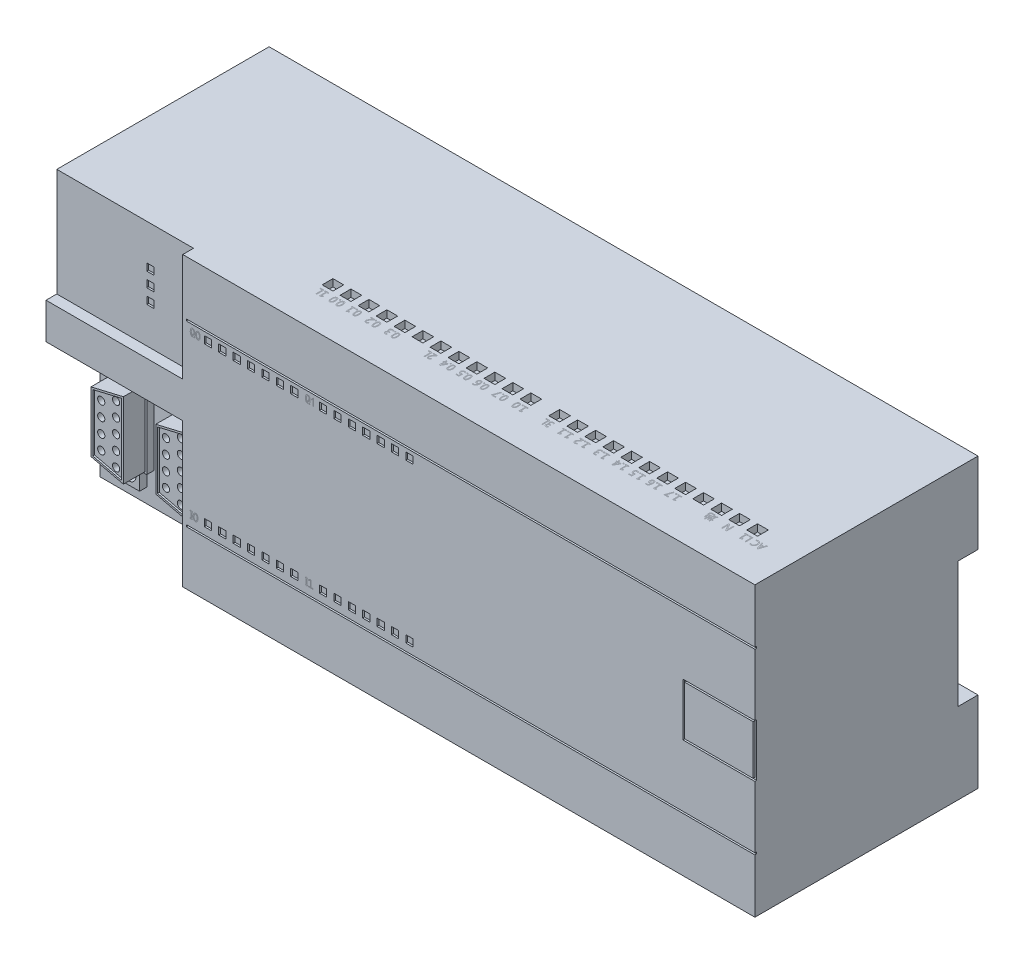
from build123d import *

# Parameters (mm, degrees)
EXTRUDE_1_DEPTH      = 197
SKETCH_2_W           = 38
SKETCH_2_H           = 40
CUT_EXTRUDE_1_DEPTH  = 15
SKETCH_2_4_W         = 20
SKETCH_2_4_H         = 14.644787542
SKETCH_2_4_W_2       = 19
SKETCH_2_4_H_2       = 13.644787542
SKETCH_2_4_W_3       = 158
SKETCH_2_4_H_3       = 0.5
SKETCH_2_4_W_4       = 2
SKETCH_2_4_H_4       = 2
CUT_EXTRUDE_2_DEPTH  = 0.5
SKETCH_2_5_W         = 38
SKETCH_2_5_H         = 30
CUT_EXTRUDE_3_DEPTH  = 3
SKETCH_2_6_W         = 2
SKETCH_2_6_H         = 2
CUT_EXTRUDE_4_DEPTH  = 3.5
CUT_EXTRUDE_5_DEPTH  = 13
SKETCH_2_8_R         = 2
CUT_EXTRUDE_6_DEPTH  = 15
SKETCH_2_9_R         = 1
CUT_EXTRUDE_7_DEPTH  = 15
CUT_EXTRUDE_8_DEPTH  = 7.5
CUT_EXTRUDE_9_DEPTH  = 7
SKETCH_4_W           = 3
SKETCH_4_H           = 3
CUT_EXTRUDE_10_DEPTH = 2
SKETCH_5_W           = 3
SKETCH_5_H           = 3
CUT_EXTRUDE_11_DEPTH = 2


with BuildPart() as part:
    # 草图1 → 凸台-拉伸1 (new body)
    with BuildSketch(Plane(origin=(0, 0, 0), x_dir=(0, 0, -1), z_dir=(1, 0, 0))):
        Polygon((62, -57.5), (62, -80), (0, -80), (0, 0), (62, 0), (62, -22.5), (56.5, -22.5), (56.5, -57.5), align=None)
    extrude(amount=EXTRUDE_1_DEPTH)

    # 草图2 → 切除-拉伸1 (cut)
    with BuildSketch(Plane.XY):
        with Locations((19, -60)):
            Rectangle(SKETCH_2_W, SKETCH_2_H)
        Polygon((7, -49.013480083), (7, -44.013480083), (13, -44.013480083), (13, -49.013480083), (15, -49.013480083), (15, -70.986519917), (13, -70.986519917), (13, -75.986519917), (7, -75.986519917), (7, -70.986519917), (5, -70.986519917), (5, -49.013480083), align=None, mode=Mode.SUBTRACT)
        Polygon((25, -49.013480083), (25, -44.013480083), (31, -44.013480083), (31, -49.013480083), (33, -49.013480083), (33, -70.986519917), (31, -70.986519917), (31, -75.986519917), (25, -75.986519917), (25, -70.986519917), (23, -70.986519917), (23, -49.013480083), align=None, mode=Mode.SUBTRACT)
    extrude(amount=-CUT_EXTRUDE_1_DEPTH, mode=Mode.SUBTRACT)

    # 草图2<4> → 切除-拉伸2 (cut)
    # profile 1 of 31: a face of its own
    with BuildSketch(Plane.XY):
        with Locations((187, -40)):
            Rectangle(SKETCH_2_4_W, SKETCH_2_4_H)
        with Locations((187, -40)):
            Rectangle(SKETCH_2_4_W_2, SKETCH_2_4_H_2, mode=Mode.SUBTRACT)
    # profile 2 of 31: a face of its own
    with BuildSketch(Plane.XY):
        with Locations((118, -15.25)):
            Rectangle(SKETCH_2_4_W_3, SKETCH_2_4_H_3)
    # profile 3 of 31: a face of its own
    with BuildSketch(Plane.XY):
        with Locations((118, -64.75)):
            Rectangle(SKETCH_2_4_W_3, SKETCH_2_4_H_3)
    # profile 4 of 31: a face of its own
    with BuildSketch(Plane.XY):
        with Locations((49, -61.5)):
            Rectangle(SKETCH_2_4_W_4, SKETCH_2_4_H_4)
    # profile 5 of 31: a face of its own
    with BuildSketch(Plane.XY):
        with Locations((45, -61.5)):
            Rectangle(SKETCH_2_4_W_4, SKETCH_2_4_H_4)
    # profile 6 of 31: a face of its own
    with BuildSketch(Plane.XY):
        with Locations((53, -61.5)):
            Rectangle(SKETCH_2_4_W_4, SKETCH_2_4_H_4)
    # profile 7 of 31: a face of its own
    with BuildSketch(Plane.XY):
        with Locations((57, -61.5)):
            Rectangle(SKETCH_2_4_W_4, SKETCH_2_4_H_4)
    # profile 8 of 31: a face of its own
    with BuildSketch(Plane.XY):
        with Locations((61, -61.5)):
            Rectangle(SKETCH_2_4_W_4, SKETCH_2_4_H_4)
    # profile 9 of 31: a face of its own
    with BuildSketch(Plane.XY):
        with Locations((65, -61.5)):
            Rectangle(SKETCH_2_4_W_4, SKETCH_2_4_H_4)
    # profile 10 of 31: a face of its own
    with BuildSketch(Plane.XY):
        with Locations((69, -61.5)):
            Rectangle(SKETCH_2_4_W_4, SKETCH_2_4_H_4)
    # profile 11 of 31: a face of its own
    with BuildSketch(Plane.XY):
        with Locations((77, -61.5)):
            Rectangle(SKETCH_2_4_W_4, SKETCH_2_4_H_4)
    # profile 12 of 31: a face of its own
    with BuildSketch(Plane.XY):
        with Locations((81, -61.5)):
            Rectangle(SKETCH_2_4_W_4, SKETCH_2_4_H_4)
    # profile 13 of 31: a face of its own
    with BuildSketch(Plane.XY):
        with Locations((85, -61.5)):
            Rectangle(SKETCH_2_4_W_4, SKETCH_2_4_H_4)
    # profile 14 of 31: a face of its own
    with BuildSketch(Plane.XY):
        with Locations((89, -61.5)):
            Rectangle(SKETCH_2_4_W_4, SKETCH_2_4_H_4)
    # profile 15 of 31: a face of its own
    with BuildSketch(Plane.XY):
        with Locations((93, -61.5)):
            Rectangle(SKETCH_2_4_W_4, SKETCH_2_4_H_4)
    # profile 16 of 31: a face of its own
    with BuildSketch(Plane.XY):
        with Locations((97, -61.5)):
            Rectangle(SKETCH_2_4_W_4, SKETCH_2_4_H_4)
    # profile 17 of 31: a face of its own
    with BuildSketch(Plane.XY):
        with Locations((101, -61.5)):
            Rectangle(SKETCH_2_4_W_4, SKETCH_2_4_H_4)
    # profile 18 of 31: a face of its own
    with BuildSketch(Plane.XY):
        with Locations((49, -17.5)):
            Rectangle(SKETCH_2_4_W_4, SKETCH_2_4_H_4)
    # profile 19 of 31: a face of its own
    with BuildSketch(Plane.XY):
        with Locations((53, -17.5)):
            Rectangle(SKETCH_2_4_W_4, SKETCH_2_4_H_4)
    # profile 20 of 31: a face of its own
    with BuildSketch(Plane.XY):
        with Locations((57, -17.5)):
            Rectangle(SKETCH_2_4_W_4, SKETCH_2_4_H_4)
    # profile 21 of 31: a face of its own
    with BuildSketch(Plane.XY):
        with Locations((61, -17.5)):
            Rectangle(SKETCH_2_4_W_4, SKETCH_2_4_H_4)
    # profile 22 of 31: a face of its own
    with BuildSketch(Plane.XY):
        with Locations((65, -17.5)):
            Rectangle(SKETCH_2_4_W_4, SKETCH_2_4_H_4)
    # profile 23 of 31: a face of its own
    with BuildSketch(Plane.XY):
        with Locations((69, -17.5)):
            Rectangle(SKETCH_2_4_W_4, SKETCH_2_4_H_4)
    # profile 24 of 31: a face of its own
    with BuildSketch(Plane.XY):
        with Locations((77, -17.5)):
            Rectangle(SKETCH_2_4_W_4, SKETCH_2_4_H_4)
    # profile 25 of 31: a face of its own
    with BuildSketch(Plane.XY):
        with Locations((81, -17.5)):
            Rectangle(SKETCH_2_4_W_4, SKETCH_2_4_H_4)
    # profile 26 of 31: a face of its own
    with BuildSketch(Plane.XY):
        with Locations((85, -17.5)):
            Rectangle(SKETCH_2_4_W_4, SKETCH_2_4_H_4)
    # profile 27 of 31: a face of its own
    with BuildSketch(Plane.XY):
        with Locations((89, -17.5)):
            Rectangle(SKETCH_2_4_W_4, SKETCH_2_4_H_4)
    # profile 28 of 31: a face of its own
    with BuildSketch(Plane.XY):
        with Locations((93, -17.5)):
            Rectangle(SKETCH_2_4_W_4, SKETCH_2_4_H_4)
    # profile 29 of 31: a face of its own
    with BuildSketch(Plane.XY):
        with Locations((97, -17.5)):
            Rectangle(SKETCH_2_4_W_4, SKETCH_2_4_H_4)
    # profile 30 of 31: a face of its own
    with BuildSketch(Plane.XY):
        with Locations((101, -17.5)):
            Rectangle(SKETCH_2_4_W_4, SKETCH_2_4_H_4)
    # profile 31 of 31: a face of its own
    with BuildSketch(Plane.XY):
        with Locations((45, -17.5)):
            Rectangle(SKETCH_2_4_W_4, SKETCH_2_4_H_4)
    extrude(amount=-CUT_EXTRUDE_2_DEPTH, mode=Mode.SUBTRACT)

    # 草图2<5> → 切除-拉伸3 (cut)
    with BuildSketch(Plane.XY):
        with Locations((19, -15)):
            Rectangle(SKETCH_2_5_W, SKETCH_2_5_H)
    extrude(amount=-CUT_EXTRUDE_3_DEPTH, mode=Mode.SUBTRACT)

    # 草图2<6> → 切除-拉伸4 (cut)
    with BuildSketch(Plane.XY):
        with Locations((26, -15)):
            Rectangle(SKETCH_2_6_W, SKETCH_2_6_H)
        with Locations((26, -11)):
            Rectangle(SKETCH_2_6_W, SKETCH_2_6_H)
        with Locations((26, -19)):
            Rectangle(SKETCH_2_6_W, SKETCH_2_6_H)
    extrude(amount=-CUT_EXTRUDE_4_DEPTH, mode=Mode.SUBTRACT)

    # 草图2<7> → 切除-拉伸5 (cut)
    # profile 1 of 2: a face of its own
    with BuildSketch(Plane.XY):
        Polygon((7, -49.013480083), (7, -44.013480083), (13, -44.013480083), (13, -49.013480083), (15, -49.013480083), (15, -70.986519917), (13, -70.986519917), (13, -75.986519917), (7, -75.986519917), (7, -70.986519917), (5, -70.986519917), (5, -49.013480083), align=None)
        Polygon((5.5, -51.60431894), (14.5, -49.479050457), (14.5, -70.520949543), (5.5, -68.39568106), align=None, mode=Mode.SUBTRACT)
    # profile 2 of 2: a face of its own
    with BuildSketch(Plane.XY):
        Polygon((25, -49.013480083), (25, -44.013480083), (31, -44.013480083), (31, -49.013480083), (33, -49.013480083), (33, -70.986519917), (31, -70.986519917), (31, -75.986519917), (25, -75.986519917), (25, -70.986519917), (23, -70.986519917), (23, -49.013480083), align=None)
        Polygon((23.5, -51.60431894), (32.5, -49.479050457), (32.5, -70.520949543), (23.5, -68.39568106), align=None, mode=Mode.SUBTRACT)
    extrude(amount=-CUT_EXTRUDE_5_DEPTH, mode=Mode.SUBTRACT)

    # 草图2<8> → 切除-拉伸6 (cut)
    with BuildSketch(Plane.XY):
        with Locations((10, -47.013480083)):
            Circle(SKETCH_2_8_R)
        with Locations((10, -72.986519917)):
            Circle(SKETCH_2_8_R)
        with Locations((28, -47.013480083)):
            Circle(SKETCH_2_8_R)
        with Locations((28, -72.986519917)):
            Circle(SKETCH_2_8_R)
    extrude(amount=-CUT_EXTRUDE_6_DEPTH, mode=Mode.SUBTRACT)

    # 草图2<9> → 切除-拉伸7 (cut)
    with BuildSketch(Plane.XY):
        with Locations((7.850312497, -54)):
            Circle(SKETCH_2_9_R)
        with Locations((7.850312497, -58)):
            Circle(SKETCH_2_9_R)
        with Locations((7.850312497, -62)):
            Circle(SKETCH_2_9_R)
        with Locations((7.850312497, -66)):
            Circle(SKETCH_2_9_R)
        with Locations((11.979833633, -52)):
            Circle(SKETCH_2_9_R)
        with Locations((11.979833633, -56)):
            Circle(SKETCH_2_9_R)
        with Locations((11.979833633, -60)):
            Circle(SKETCH_2_9_R)
        with Locations((11.979833633, -64)):
            Circle(SKETCH_2_9_R)
        with Locations((11.979833633, -68)):
            Circle(SKETCH_2_9_R)
        with Locations((25.850312497, -54)):
            Circle(SKETCH_2_9_R)
        with Locations((25.850312497, -58)):
            Circle(SKETCH_2_9_R)
        with Locations((25.850312497, -62)):
            Circle(SKETCH_2_9_R)
        with Locations((25.850312497, -66)):
            Circle(SKETCH_2_9_R)
        with Locations((29.979833633, -52)):
            Circle(SKETCH_2_9_R)
        with Locations((29.979833633, -56)):
            Circle(SKETCH_2_9_R)
        with Locations((29.979833633, -60)):
            Circle(SKETCH_2_9_R)
        with Locations((29.979833633, -64)):
            Circle(SKETCH_2_9_R)
        with Locations((29.979833633, -68)):
            Circle(SKETCH_2_9_R)
    extrude(amount=-CUT_EXTRUDE_7_DEPTH, mode=Mode.SUBTRACT)

    # 草图2<10> → 切除-拉伸8 (cut)
    with BuildSketch(Plane.XY):
        Polygon((6, -52), (6, -68), (14, -69.88912754), (14, -50.11087246), align=None)
        Polygon((24, -52), (24, -68), (32, -69.88912754), (32, -50.11087246), align=None)
    extrude(amount=-CUT_EXTRUDE_8_DEPTH, mode=Mode.SUBTRACT)

    # 草图2<11> → 切除-拉伸9 (cut)
    with BuildSketch(Plane.XY):
        Polygon((5.5, -51.60431894), (14.5, -49.479050457), (14.5, -70.520949543), (5.5, -68.39568106), align=None)
        Polygon((25, -49.013480083), (25, -44.013480083), (31, -44.013480083), (31, -49.013480083), (33, -49.013480083), (33, -70.986519917), (31, -70.986519917), (31, -75.986519917), (25, -75.986519917), (25, -70.986519917), (23, -70.986519917), (23, -49.013480083), align=None)
    extrude(amount=-CUT_EXTRUDE_9_DEPTH, mode=Mode.SUBTRACT)

    # 草图4 → 切除-拉伸10 (cut)
    with BuildSketch(Plane.XZ.offset(80)):
        with Locations((52.1687947, -13.566222237)):
            Rectangle(SKETCH_4_W, SKETCH_4_H)
        with Locations((47.1687947, -13.566222237)):
            Rectangle(SKETCH_4_W, SKETCH_4_H)
        with Locations((57.1687947, -13.566222237)):
            Rectangle(SKETCH_4_W, SKETCH_4_H)
        with Locations((62.1687947, -13.566222237)):
            Rectangle(SKETCH_4_W, SKETCH_4_H)
        with Locations((67.1687947, -13.566222237)):
            Rectangle(SKETCH_4_W, SKETCH_4_H)
        with Locations((72.1687947, -13.566222237)):
            Rectangle(SKETCH_4_W, SKETCH_4_H)
        with Locations((77.1687947, -13.566222237)):
            Rectangle(SKETCH_4_W, SKETCH_4_H)
        with Locations((82.1687947, -13.566222237)):
            Rectangle(SKETCH_4_W, SKETCH_4_H)
        with Locations((87.1687947, -13.566222237)):
            Rectangle(SKETCH_4_W, SKETCH_4_H)
        with Locations((92.1687947, -13.566222237)):
            Rectangle(SKETCH_4_W, SKETCH_4_H)
        with Locations((97.1687947, -13.566222237)):
            Rectangle(SKETCH_4_W, SKETCH_4_H)
        with Locations((102.1687947, -13.566222237)):
            Rectangle(SKETCH_4_W, SKETCH_4_H)
        with Locations((107.1687947, -13.566222237)):
            Rectangle(SKETCH_4_W, SKETCH_4_H)
        with Locations((112.1687947, -13.566222237)):
            Rectangle(SKETCH_4_W, SKETCH_4_H)
        with Locations((122.1687947, -13.566222237)):
            Rectangle(SKETCH_4_W, SKETCH_4_H)
        with Locations((127.1687947, -13.566222237)):
            Rectangle(SKETCH_4_W, SKETCH_4_H)
        with Locations((132.1687947, -13.566222237)):
            Rectangle(SKETCH_4_W, SKETCH_4_H)
        with Locations((137.1687947, -13.566222237)):
            Rectangle(SKETCH_4_W, SKETCH_4_H)
        with Locations((152.1687947, -13.566222237)):
            Rectangle(SKETCH_4_W, SKETCH_4_H)
        with Locations((157.1687947, -13.566222237)):
            Rectangle(SKETCH_4_W, SKETCH_4_H)
        with Locations((147.1687947, -13.566222237)):
            Rectangle(SKETCH_4_W, SKETCH_4_H)
        with Locations((142.1687947, -13.566222237)):
            Rectangle(SKETCH_4_W, SKETCH_4_H)
        with Locations((162.1687947, -13.566222237)):
            Rectangle(SKETCH_4_W, SKETCH_4_H)
        with Locations((167.1687947, -13.566222237)):
            Rectangle(SKETCH_4_W, SKETCH_4_H)
        with Locations((177.1687947, -13.566222237)):
            Rectangle(SKETCH_4_W, SKETCH_4_H)
        with Locations((182.1687947, -13.566222237)):
            Rectangle(SKETCH_4_W, SKETCH_4_H)
        with Locations((187.1687947, -13.566222237)):
            Rectangle(SKETCH_4_W, SKETCH_4_H)
        with Locations((172.1687947, -13.566222237)):
            Rectangle(SKETCH_4_W, SKETCH_4_H)
    extrude(amount=-CUT_EXTRUDE_10_DEPTH, mode=Mode.SUBTRACT)

    # 草图5 → 切除-拉伸11 (cut)
    with BuildSketch(Plane(origin=(0, 0, 0), x_dir=(1, 0, 0), z_dir=(0, 1, 0))):
        with Locations((149.1687947, 13.566222237)):
            Rectangle(SKETCH_5_W, SKETCH_5_H)
        with Locations((174.1687947, 13.566222237)):
            Rectangle(SKETCH_5_W, SKETCH_5_H)
        with Locations((134.1687947, 13.566222237)):
            Rectangle(SKETCH_5_W, SKETCH_5_H)
        with Locations((159.1687947, 13.566222237)):
            Rectangle(SKETCH_5_W, SKETCH_5_H)
        with Locations((179.1687947, 13.566222237)):
            Rectangle(SKETCH_5_W, SKETCH_5_H)
        with Locations((144.1687947, 13.566222237)):
            Rectangle(SKETCH_5_W, SKETCH_5_H)
        with Locations((169.1687947, 13.566222237)):
            Rectangle(SKETCH_5_W, SKETCH_5_H)
        with Locations((154.1687947, 13.566222237)):
            Rectangle(SKETCH_5_W, SKETCH_5_H)
        with Locations((139.1687947, 13.566222237)):
            Rectangle(SKETCH_5_W, SKETCH_5_H)
        with Locations((164.1687947, 13.566222237)):
            Rectangle(SKETCH_5_W, SKETCH_5_H)
        with Locations((184.1687947, 13.566222237)):
            Rectangle(SKETCH_5_W, SKETCH_5_H)
        with Locations((129.1687947, 13.566222237)):
            Rectangle(SKETCH_5_W, SKETCH_5_H)
        with Locations((66.1687947, 13.566222237)):
            Rectangle(SKETCH_5_W, SKETCH_5_H)
        with Locations((71.1687947, 13.566222237)):
            Rectangle(SKETCH_5_W, SKETCH_5_H)
        with Locations((76.1687947, 13.566222237)):
            Rectangle(SKETCH_5_W, SKETCH_5_H)
        with Locations((81.1687947, 13.566222237)):
            Rectangle(SKETCH_5_W, SKETCH_5_H)
        with Locations((86.1687947, 13.566222237)):
            Rectangle(SKETCH_5_W, SKETCH_5_H)
        with Locations((91.1687947, 13.566222237)):
            Rectangle(SKETCH_5_W, SKETCH_5_H)
        with Locations((96.1687947, 13.566222237)):
            Rectangle(SKETCH_5_W, SKETCH_5_H)
        with Locations((101.1687947, 13.566222237)):
            Rectangle(SKETCH_5_W, SKETCH_5_H)
        with Locations((106.1687947, 13.566222237)):
            Rectangle(SKETCH_5_W, SKETCH_5_H)
        with Locations((111.1687947, 13.566222237)):
            Rectangle(SKETCH_5_W, SKETCH_5_H)
        with Locations((116.1687947, 13.566222237)):
            Rectangle(SKETCH_5_W, SKETCH_5_H)
        with Locations((121.1687947, 13.566222237)):
            Rectangle(SKETCH_5_W, SKETCH_5_H)
    extrude(amount=-CUT_EXTRUDE_11_DEPTH, mode=Mode.SUBTRACT)


solid = part.part
